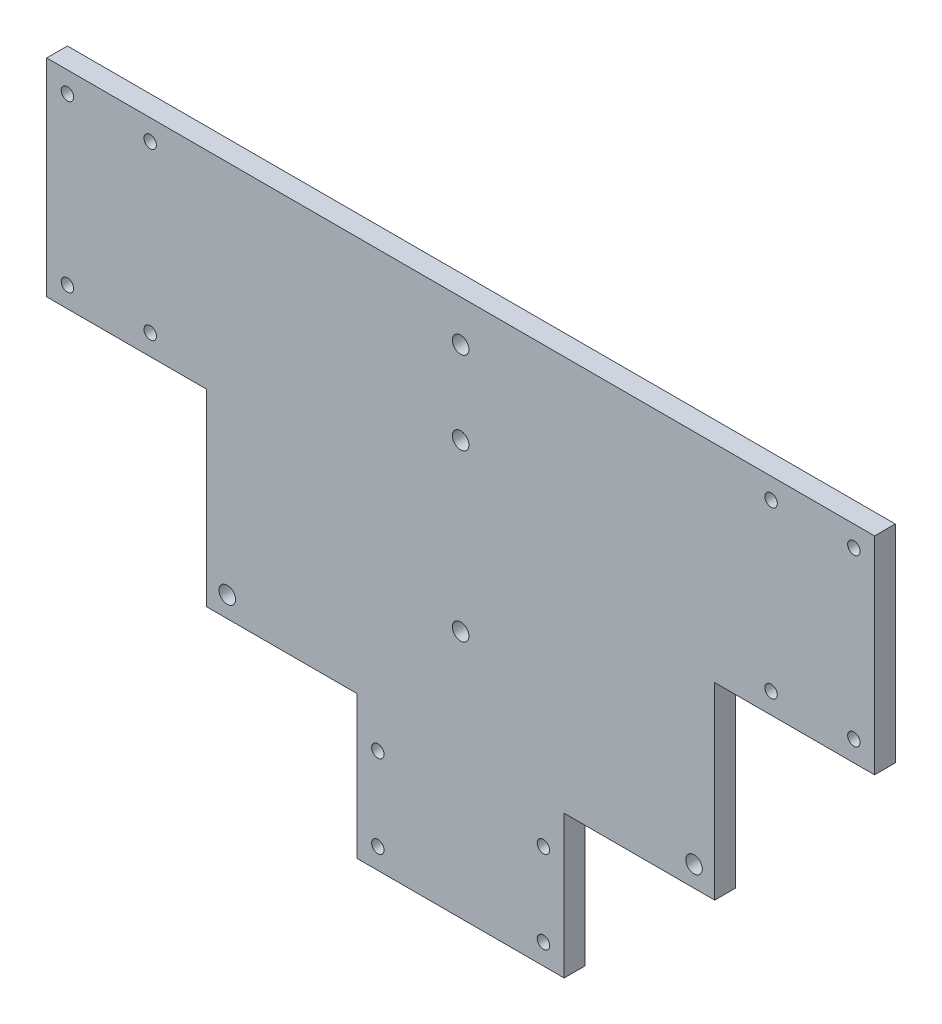
from build123d import *

# Parameters (mm, degrees)
ESQUISSE1_R        = 2
ESQUISSE1_R_2      = 1.5
BOSS_EXTRU_1_DEPTH = 5


with BuildPart() as part:
    # Esquisse1 → Boss.-Extru.1 (new body)
    with BuildSketch(Plane.XY):
        Polygon((0, 50), (-100, 50), (-100, 0), (-61.381557247, 0), (-61.381557247, -45.5212086), (-25, -45.5212086), (-25, -80), (25, -80), (25, -45.5212086), (61.381557247, -45.5212086), (61.381557247, 0), (100, 0), (100, 50), align=None)
        with Locations((0, 20)):
            Circle(ESQUISSE1_R, mode=Mode.SUBTRACT)
        with Locations((0, -20)):
            Circle(ESQUISSE1_R, mode=Mode.SUBTRACT)
        with Locations((0, 40)):
            Circle(ESQUISSE1_R, mode=Mode.SUBTRACT)
        with Locations((-20, -55)):
            Circle(ESQUISSE1_R_2, mode=Mode.SUBTRACT)
        with Locations((20, -55)):
            Circle(ESQUISSE1_R_2, mode=Mode.SUBTRACT)
        with Locations((20, -75)):
            Circle(ESQUISSE1_R_2, mode=Mode.SUBTRACT)
        with Locations((-20, -75)):
            Circle(ESQUISSE1_R_2, mode=Mode.SUBTRACT)
        with Locations((-95, 45)):
            Circle(ESQUISSE1_R_2, mode=Mode.SUBTRACT)
        with Locations((-75, 45)):
            Circle(ESQUISSE1_R_2, mode=Mode.SUBTRACT)
        with Locations((-75, 5)):
            Circle(ESQUISSE1_R_2, mode=Mode.SUBTRACT)
        with Locations((-95, 5)):
            Circle(ESQUISSE1_R_2, mode=Mode.SUBTRACT)
        with Locations((75, 5)):
            Circle(ESQUISSE1_R_2, mode=Mode.SUBTRACT)
        with Locations((95, 5)):
            Circle(ESQUISSE1_R_2, mode=Mode.SUBTRACT)
        with Locations((75, 45)):
            Circle(ESQUISSE1_R_2, mode=Mode.SUBTRACT)
        with Locations((95, 45)):
            Circle(ESQUISSE1_R_2, mode=Mode.SUBTRACT)
        with Locations((56.381557247, -40.5212086)):
            Circle(ESQUISSE1_R, mode=Mode.SUBTRACT)
        with Locations((-56.381557247, -40.5212086)):
            Circle(ESQUISSE1_R, mode=Mode.SUBTRACT)
    extrude(amount=BOSS_EXTRU_1_DEPTH)


solid = part.part
